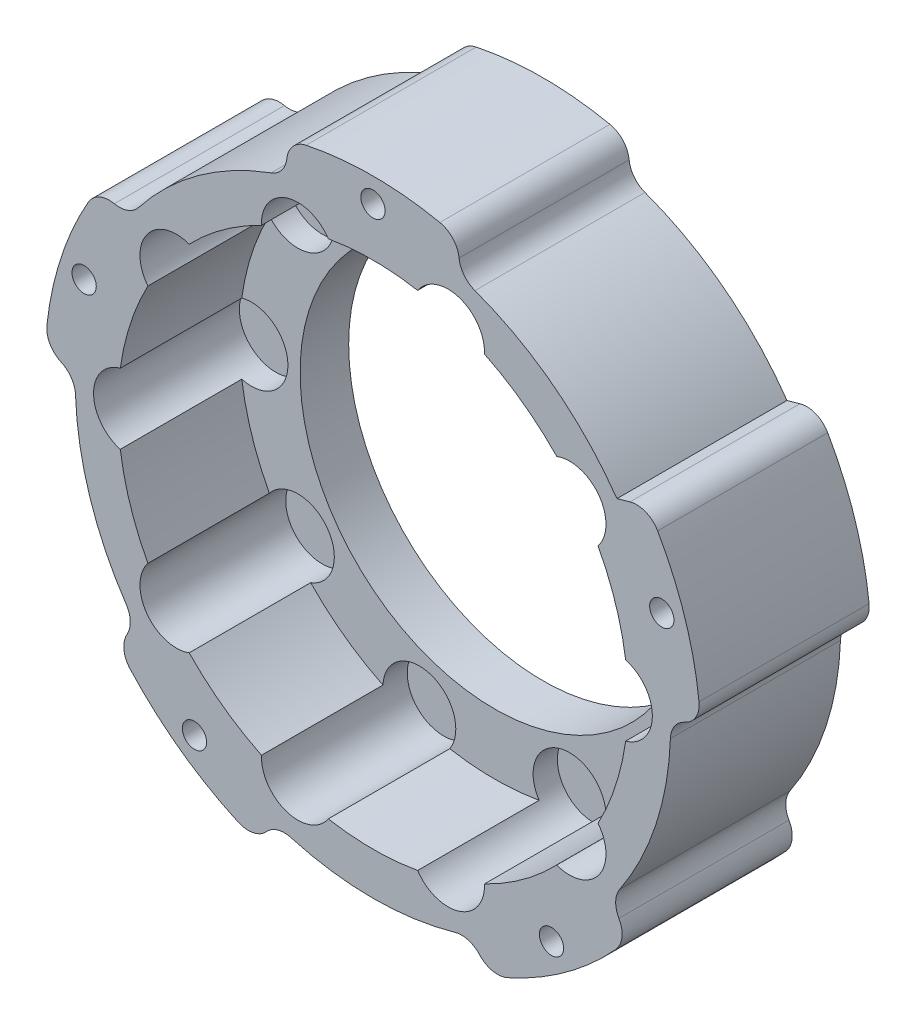
from build123d import *

# Parameters (mm, degrees)
SKETCH_1_R          = 25
EXTRUDE_1_DEPTH     = 2
SKETCH_2_R          = 2.9999999999999973
SKETCH_2_R_2        = 2.999999999999996
SKETCH_2_R_3        = 2.999999999999999
SKETCH_2_R_4        = 3
SKETCH_2_R_5        = 2.999999999999997
SKETCH_2_R_6        = 2.9999999999999982
EXTRUDE_2_DEPTH     = 10
SKETCH_3_R          = 16
CUT_EXTRUDE_1_DEPTH = 10
CUT_EXTRUDE_START   = -12
SKETCH_4_R          = 2.999999999999994
SKETCH_4_R_2        = 2.9999999999999973
SKETCH_4_R_3        = 2.999999999999997
SKETCH_4_R_4        = 2.9999999999999996
SKETCH_4_R_5        = 2.999999999999999
CUT_EXTRUDE_2_DEPTH = 12
SKETCH_5_R          = 25
EXTRUDE_3_DEPTH     = 12
SKETCH_7_R          = 25
SKETCH_7_R_2        = 16
EXTRUDE_4_DEPTH     = 2
SKETCH_8_R          = 25
CUT_EXTRUDE_3_DEPTH = 2
SKETCH_9_R          = 1.0000000000000007
SKETCH_9_R_2        = 1.0000000000000009
SKETCH_9_R_3        = 1
SKETCH_9_R_4        = 1.0000000000000013
SKETCH_9_R_5        = 1.0000000000000018
SKETCH_9_R_6        = 0.9999999999999993
SKETCH_9_R_7        = 1.0000000000000056
SKETCH_9_R_8        = 0.9999999999999979
SKETCH_9_R_9        = 1.000000000000004
CUT_EXTRUDE_4_DEPTH = 15
SKETCH_10_R         = 27
SKETCH_10_R_2       = 25
EXTRUDE_5_DEPTH     = 14
SKETCH_11_R         = 1.0000000000000013
SKETCH_11_R_2       = 1.0000000000000018
SKETCH_11_R_3       = 1.0000000000000002
SKETCH_11_R_4       = 0.9999999999999983
SKETCH_11_R_5       = 1.0000000000000056
SKETCH_11_R_6       = 1.0000000000000053
EXTRUDE_6_DEPTH     = 14
SKETCH_12_R         = 1.000000000002179
SKETCH_12_R_2       = 1.0000000000021785
SKETCH_12_R_3       = 1.000000000002178
SKETCH_12_R_4       = 1.0000000000021796
CUT_EXTRUDE_5_DEPTH = 14
CUT_EXTRUDE_7_DEPTH = 22
FILLET_1_R          = 2
FILLET_2_R          = 2
FILLET_3_R          = 2
FILLET_4_R          = 2


with BuildPart() as part:
    # 草图1 → 凸台-拉伸1 (new body)
    with BuildSketch(Plane.XY):
        Circle(SKETCH_1_R)
    extrude(amount=EXTRUDE_1_DEPTH)

    # 草图2 → 凸台-拉伸2 (add)
    with BuildSketch(Plane.XY.offset(2)):
        with Locations((20, 0)):
            Circle(SKETCH_2_R)
        with Locations((16.18033988749894, -11.755705045849487)):
            Circle(SKETCH_2_R_2)
        with Locations((6.180339887498899, -19.021130325903094)):
            Circle(SKETCH_2_R_3)
        with Locations((-6.180339887499034, -19.021130325903048)):
            Circle(SKETCH_2_R_4)
        with Locations((-16.180339887499017, -11.755705045849368)):
            Circle(SKETCH_2_R_5)
        with Locations((-20, 1.3966e-13)):
            Circle(SKETCH_2_R_6)
        with Locations((-16.180339887498842, 11.755705045849606)):
            Circle(SKETCH_2_R_3)
        with Locations((-6.180339887498764, 19.021130325903133)):
            Circle(SKETCH_2_R_5)
        with Locations((6.180339887499164, 19.021130325903002)):
            Circle(SKETCH_2_R_5)
        with Locations((16.180339887499105, 11.755705045849252)):
            Circle(SKETCH_2_R_5)
    extrude(amount=EXTRUDE_2_DEPTH)

    # 草图3 → 切除-拉伸1 (cut)
    with BuildSketch(Plane.XY.offset(2)):
        Circle(SKETCH_3_R)
    extrude(amount=-CUT_EXTRUDE_1_DEPTH, mode=Mode.SUBTRACT)

    # 草图4 → 切除-拉伸2 (cut)
    with BuildSketch(Plane.XY.offset(12).offset(CUT_EXTRUDE_START)):
        with Locations((16.180339887499105, 11.755705045849252)):
            Circle(SKETCH_4_R)
        with Locations((6.180339887499164, 19.021130325903002)):
            Circle(SKETCH_4_R_2)
        with Locations((-6.180339887498764, 19.021130325903133)):
            Circle(SKETCH_4_R_3)
        with Locations((-16.180339887498842, 11.755705045849606)):
            Circle(SKETCH_4_R_4)
        with Locations((-20, 1.3966e-13)):
            Circle(SKETCH_4_R_2)
        with Locations((-16.180339887499017, -11.755705045849368)):
            Circle(SKETCH_4_R_2)
        with Locations((-6.180339887499034, -19.021130325903048)):
            Circle(SKETCH_4_R_4)
        with Locations((16.18033988749894, -11.755705045849487)):
            Circle(SKETCH_4_R)
        with Locations((20, 0)):
            Circle(SKETCH_4_R_2)
        with Locations((6.180339887498899, -19.021130325903094)):
            Circle(SKETCH_4_R_5)
    extrude(amount=CUT_EXTRUDE_2_DEPTH, mode=Mode.SUBTRACT)

    # 草图5 → 凸台-拉伸3 (add)
    with BuildSketch(Plane.XY.offset(2)):
        Circle(SKETCH_5_R)
        with BuildLine():
            ThreePointArc((18.527056046548942, 9.886768645418698), (19.972186842198262, 6.489356881873777), (20.799999999999997, 2.8913664589602024))
            ThreePointArc((20.8, 2.891366458960203), (23.00000000000001, -4.4e-16), (20.8, -2.8913664589602033))
            ThreePointArc((20.799999999999997, -2.89136645896021), (19.972186842198212, -6.4893568818739364), (18.527056046548797, -9.886768645418973))
            ThreePointArc((18.527056046548804, -9.886768645418968), (18.60739087062377, -13.519060802726909), (15.128050919448983, -14.56509784994797))
            ThreePointArc((15.12805091944897, -14.565097849947978), (12.343490298141901, -16.98935688187392), (9.177406394790198, -18.8884941661548))
            ThreePointArc((9.1774063947902, -18.8884941661548), (7.107390870623737, -21.874299874788566), (3.677700571207507, -20.67545691172362))
            ThreePointArc((3.6777005712075, -20.67545691172362), (-7.846e-14, -21), (-3.6777005712076543, -20.675456911723593))
            ThreePointArc((-3.6777005712076534, -20.675456911723593), (-7.107390870623893, -21.874299874788516), (-9.177406394790339, -18.88849416615474))
            ThreePointArc((-9.177406394790339, -18.888494166154732), (-12.34349029814203, -16.989356881873828), (-15.128050919449079, -14.565097849947863))
            ThreePointArc((-15.128050919449075, -14.565097849947865), (-18.607390870623878, -13.519060802726777), (-18.52705604654888, -9.886768645418814))
            ThreePointArc((-18.527056046548882, -9.88676864541881), (-19.972186842198266, -6.4893568818737695), (-20.80000000000002, -2.891366458960054))
            ThreePointArc((-20.80000000000002, -2.891366458960057), (-23.00000000000001, 1.6231e-13), (-20.799999999999976, 2.8913664589603485))
            ThreePointArc((-20.799999999999976, 2.891366458960355), (-19.972186842198173, 6.489356881874057), (-18.527056046548736, 9.886768645419087))
            ThreePointArc((-18.527056046548736, 9.886768645419089), (-18.607390870623675, 13.519060802727054), (-15.128050919448857, 14.565097849948092))
            ThreePointArc((-15.128050919448855, 14.565097849948096), (-12.343490298141768, 16.989356881874016), (-9.17740639479005, 18.888494166154874))
            ThreePointArc((-9.177406394790053, 18.888494166154874), (-7.107390870623576, 21.874299874788594), (-3.67770057120738, 20.675456911723643))
            ThreePointArc((-3.677700571207379, 20.675456911723643), (2.1112e-13, 21), (3.6777005712077946, 20.67545691172357))
            ThreePointArc((3.677700571207796, 20.675456911723565), (7.107390870624042, 21.874299874788463), (9.177406394790463, 18.888494166154672))
            ThreePointArc((9.177406394790463, 18.888494166154672), (12.343490298142148, 16.989356881873743), (15.128050919449189, 14.56509784994775))
            ThreePointArc((15.12805091944919, 14.565097849947751), (18.607390870623963, 13.519060802726637), (18.527056046548942, 9.886768645418698))
        make_face(mode=Mode.SUBTRACT)
    extrude(amount=EXTRUDE_3_DEPTH)

    # 草图7 → 凸台-拉伸4 (add)
    with BuildSketch(Plane(origin=(0, 0, 0), x_dir=(-1, 0, 0), z_dir=(0, 0, -1))):
        Circle(SKETCH_7_R)
        with Locations(Location((0, 0, 0), (0, 0, 180))):
            Circle(SKETCH_7_R_2, mode=Mode.SUBTRACT)
    extrude(amount=EXTRUDE_4_DEPTH)

    # 草图8 → 切除-拉伸3 (cut)
    with BuildSketch(Plane.XY.offset(14)):
        with Locations(Location((0, 0, 0), (0, 0, 180))):
            Circle(SKETCH_8_R)
    extrude(amount=-CUT_EXTRUDE_3_DEPTH, mode=Mode.SUBTRACT)

    # 草图9 → 切除-拉伸4 (cut)
    with BuildSketch(Plane.XY.offset(12)):
        with Locations((21.87429987478853, -7.107390870623803)):
            Circle(SKETCH_9_R)
        with Locations((13.51906080272685, -18.607390870623824)):
            Circle(SKETCH_9_R_2)
        with Locations((-7.72e-14, -23.000000000000007)):
            Circle(SKETCH_9_R_3)
        with Locations((-13.519060802726976, -18.60739087062372)):
            Circle(SKETCH_9_R_4)
        with Locations((-21.87429987478858, -7.107390870623654)):
            Circle(SKETCH_9_R_5)
        with Locations((-21.87429987478848, 7.107390870623958)):
            Circle(SKETCH_9_R_6)
        with Locations((-13.519060802726708, 18.607390870623917)):
            Circle(SKETCH_9_R_2)
        with Locations((2.3592e-13, 23)):
            Circle(SKETCH_9_R_7)
        with Locations((13.51906080272711, 18.607390870623636)):
            Circle(SKETCH_9_R_8)
        with Locations((21.874299874788626, 7.107390870623489)):
            Circle(SKETCH_9_R_9)
    extrude(amount=-CUT_EXTRUDE_4_DEPTH, mode=Mode.SUBTRACT)

    # 草图10 → 凸台-拉伸5 (add)
    with BuildSketch(Plane.XY.offset(12)):
        Circle(SKETCH_10_R)
        Circle(SKETCH_10_R_2, mode=Mode.SUBTRACT)
    extrude(amount=-EXTRUDE_5_DEPTH)

    # 草图11 → 凸台-拉伸6 (add)
    with BuildSketch(Plane.XY.offset(12)):
        with Locations((-21.87429987478848, 7.107390870623958)):
            Circle(SKETCH_11_R)
        with Locations((-21.87429987478858, -7.107390870623654)):
            Circle(SKETCH_11_R)
        with Locations((-13.519060802726976, -18.60739087062372)):
            Circle(SKETCH_11_R_2)
        with Locations((-7.72e-14, -23.000000000000007)):
            Circle(SKETCH_11_R_3)
        with Locations((13.51906080272685, -18.607390870623824)):
            Circle(SKETCH_11_R_2)
        with Locations((21.87429987478853, -7.107390870623803)):
            Circle(SKETCH_11_R)
        with Locations((13.51906080272711, 18.607390870623636)):
            Circle(SKETCH_11_R_4)
        with Locations((2.3592e-13, 23)):
            Circle(SKETCH_11_R_5)
        with Locations((-13.519060802726708, 18.607390870623917)):
            Circle(SKETCH_11_R_2)
        with Locations((21.874299874788626, 7.107390870623489)):
            Circle(SKETCH_11_R_6)
    extrude(amount=-EXTRUDE_6_DEPTH)

    # 草图12 → 切除-拉伸5 (cut)
    with BuildSketch(Plane.XY.offset(12)):
        with Locations((-4.1e-14, 24.99999999999939)):
            Circle(SKETCH_12_R)
        with Locations((23.77641290737897, 7.72542485937453)):
            Circle(SKETCH_12_R_2)
        with Locations((14.694631307313387, -20.225424859372556)):
            Circle(SKETCH_12_R_3)
        with Locations((-14.694631307309555, -20.225424859373828)):
            Circle(SKETCH_12_R_4)
        with Locations((-23.776412907377555, 7.725424859372463)):
            Circle(SKETCH_12_R_2)
    extrude(amount=-CUT_EXTRUDE_5_DEPTH, mode=Mode.SUBTRACT)

    # 草图13 → 切除-拉伸7 (cut)
    with BuildSketch(Plane.XY.offset(12)):
        with BuildLine():
            Line((-8.000000000001988, -23.15707235381819), (-9.623728197368235, -25.226649709844363))
            ThreePointArc((-9.623728197368237, -25.226649709844366), (-8.816326530615193, -25.52003892053426), (-8.00000000000213, -25.78759391645486))
            ThreePointArc((-8.000000000002057, -25.787593916454625), (-2.14762e-12, -27), (7.999999999997949, -25.78759391645589))
            ThreePointArc((7.999999999997868, -25.787593916455624), (8.816326530611235, -25.520038920535), (9.623728197364583, -25.22664970984507))
            Line((9.62372819736458, -25.226649709845066), (7.999999999999232, -23.157072353819146))
            ThreePointArc((7.9999999999992255, -23.157072353819146), (-1.46061e-12, -24.50000000000005), (-8.000000000001988, -23.157072353818187))
        make_face()
        with BuildLine():
            Line((19.551548605416773, -14.764381027663427), (21.01807402861039, -16.948172884645988))
            ThreePointArc((21.018074028610393, -16.94817288464599), (21.546604585560914, -16.27095052028251), (22.053323278816983, -15.577256894587883))
            ThreePointArc((22.053323278817036, -15.577256894587922), (25.67852593996839, -8.343458848125918), (26.99759518881758, -0.36035263386590666))
            ThreePointArc((26.997595188817435, -0.3603526338659033), (26.99939879051069, -0.18018032901160086), (26.999999999999858, -6.7e-16))
            ThreePointArc((26.999999999999858, -6.7e-16), (26.99146493924519, 0.6788375604585586), (26.965865153074702, 1.3572459416711162))
            Line((26.965865153074702, 1.357245941671117), (24.495820515417392, 0.4525232330598386))
            ThreePointArc((24.4958205154174, 0.45252323305983855), (23.30088464923078, -7.570916362187881), (19.551548605416777, -14.76438102766343))
        make_face()
        with BuildLine():
            Line((-21.018074028612396, -16.948172884643373), (-19.551548605418752, -14.764381027660828))
            ThreePointArc((-19.551548605418755, -14.764381027660827), (-23.300884649231797, -7.57091636218478), (-24.49582051541734, 0.45252323306309894))
            Line((-24.49582051541734, 0.452523233063099), (-26.965865153074635, 1.357245941674412))
            ThreePointArc((-26.96586515307464, 1.357245941674412), (-26.99539403739857, 0.49869907317212836), (-26.997595188817584, -0.36035263386122796))
            ThreePointArc((-26.99759518881765, -0.36035263386122873), (-25.67852593996984, -8.34345884812147), (-22.05332327881974, -15.577256894584103))
            ThreePointArc((-22.053323278819626, -15.577256894584023), (-21.54660458556326, -16.270950520279282), (-21.018074028612396, -16.948172884643373))
        make_face()
        with BuildLine():
            ThreePointArc((-21.62970335119759, 16.16031970411429), (-22.1328605066438, 15.46403846973485), (-22.61361232510881, 14.752102819926334))
            Line((-22.613612325108807, 14.752102819926334), (-20.08352157084352, 14.032183055870734))
            ThreePointArc((-20.083521570843523, 14.032183055870734), (-14.40073868116433, 19.82091636218719), (-7.139249660842761, 23.436747092550178))
            Line((-7.1392496608427605, 23.436747092550178), (-7.042093003278574, 26.06547383289188))
            ThreePointArc((-7.042093003278575, 26.065473832891882), (-7.867744524193498, 25.828251897912484), (-8.685431441197716, 25.564883740792776))
            ThreePointArc((-8.68543144119774, 25.564883740792844), (-15.870201811894914, 21.84345884812494), (-21.629703351197705, 16.16031970411437))
        make_face()
        with BuildLine():
            ThreePointArc((8.685431441202136, 25.5648837407912), (7.867744524197297, 25.82825189791124), (7.042093003281741, 26.065473832890937))
            Line((7.042093003281742, 26.065473832890934), (7.1392496608458895, 23.436747092549233))
            ThreePointArc((7.139249660845888, 23.436747092549233), (14.40073868116698, 19.82091636218528), (20.08352157084539, 14.032183055868058))
            Line((20.08352157084539, 14.032183055868057), (22.613612325110687, 14.752102819923621))
            ThreePointArc((22.613612325110687, 14.752102819923621), (22.132860506646153, 15.464038469731623), (21.629703351200448, 16.16031970411058))
            ThreePointArc((21.62970335120051, 16.160319704110627), (15.870201811898703, 21.843458848122182), (8.685431441202173, 25.56488374079133))
        make_face()
    extrude(amount=-CUT_EXTRUDE_7_DEPTH, mode=Mode.SUBTRACT)

    # 圆角1
    fillet_1_edges = [part.edges().sort_by_distance(p)[0] for p in [
        (9.623728197364583, -25.22664970984507, 5),
    ]]
    fillet(fillet_1_edges, radius=FILLET_1_R)

    # 圆角2
    # the kernel refuses this fillet: 2 mm, written as the material it adds along each edge
    with BuildSketch(Plane(origin=(7.999999999999229, -23.157072353819146, 12), x_dir=(0.6202459479236111, -0.7844073967552455, 0), z_dir=(0, 0, -1))) as fillet_2_piece_1:
        with BuildLine():
            CenterArc((1.3800097701122314, 1.9957647241378909), FILLET_2_R, 202.3654424349486, 63.9051473709884)
            Line((-0.4695416408337477, 1.2347393774721307), (-0.6544967819283467, 1.1586368428055536))
            ThreePointArc((-0.6544967819283467, 1.1586368428055536), (-0.41338697719962225, 0.5494462671092093), (-0.18878813408098413, -0.0660230295443988))
            Line((-0.18878813408098413, -0.0660230295443988), (0.00075897957255916, -0.1999985598698377))
            ThreePointArc((0.00075897957255916, -0.1999985598698377), (1.1130008158552183, -0.19577768530936826), (1.2369117941550487, -0.19957647241378879))
            Line((1.2369117941550487, -0.19957647241378879), (1.2499207010602458, -2e-17))
        make_face()
    extrude(amount=14)

    # 圆角3
    fillet_3_edges = [part.edges().sort_by_distance(p)[0] for p in [
        (22.613612325110687, 14.752102819923621, 5),
        (7.042093003281742, 26.065473832890937, 5),
        (-7.042093003278573, 26.065473832891882, 5),
        (-22.61361232510881, 14.752102819926332, 5),
        (-26.96586515307464, 1.357245941674412, 5),
        (-21.0180740286124, -16.948172884643377, 5),
        (21.018074028610393, -16.94817288464599, 5),
        (26.965865153074702, 1.3572459416711165, 5),
        (-9.623728197368237, -25.226649709844366, 5),
    ]]
    fillet(fillet_3_edges, radius=FILLET_3_R)

    # 圆角4
    fillet_4_edges = [part.edges().sort_by_distance(p)[0] for p in [
        (-8.00000000000199, -23.157072353818187, 5),
        (19.551548605416777, -14.764381027663429, 5),
        (24.4958205154174, 0.45252323305983866, 5),
        (7.139249660845889, 23.436747092549233, 5),
        (-7.139249660842758, 23.436747092550178, 5),
        (-20.083521570843523, 14.032183055870735, 5),
        (-24.49582051541734, 0.45252323306309916, 5),
        (-19.551548605418752, -14.764381027660828, 5),
    ]]
    fillet(fillet_4_edges, radius=FILLET_4_R)


solid = part.part
